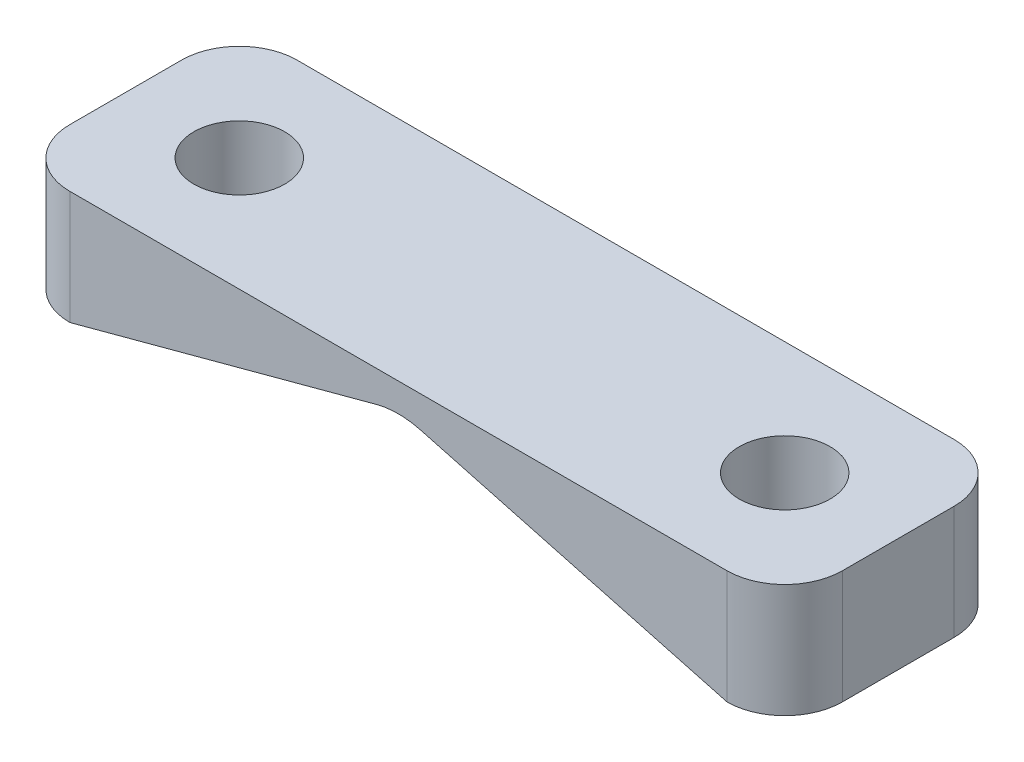
from build123d import *

# Parameters (mm, degrees)
SKETCH1_W               = 34
SKETCH1_H               = 5
BOSS_EXTRUDE1_DEPTH     = 10
CUT_EXTRUDE1_DEPTH      = 36.791060336
CUT_EXTRUDE1_DEPTH_BACK = 36.791060336
SKETCH2_R               = 3.75
FILLET1_R               = 2.54
F_4_0MM_DOWEL_HOLE1_D   = 4
CUT_EXTRUDE2_DEPTH      = 36.791060336


with BuildPart() as part:
    # Sketch1 → Boss-Extrude1 (new body)
    with BuildSketch(Plane.XY):
        with Locations((17, 2.5)):
            Rectangle(SKETCH1_W, SKETCH1_H)
    extrude(amount=BOSS_EXTRUDE1_DEPTH)

    # Sketch2 → Cut-Extrude1 (cut, two sides: drawn at the far end of the back side and taken through both)
    with BuildSketch(Plane.XY.offset(10).offset(-CUT_EXTRUDE1_DEPTH_BACK)):
        with Locations((17, 0)):
            Circle(SKETCH2_R)
    extrude(amount=CUT_EXTRUDE1_DEPTH + CUT_EXTRUDE1_DEPTH_BACK, mode=Mode.SUBTRACT)

    # Fillet1
    fillet1_edges = [part.edges().sort_by_distance(p)[0] for p in [
        (0, 2.5, 0),
        (34, 2.5, 0),
        (34, 2.5, 10),
        (0, 2.5, 10),
    ]]
    fillet(fillet1_edges, radius=FILLET1_R)

    # Ø4.0mm Dowel Hole1 (through all)
    with Locations(Plane(origin=(0, 5, 0), x_dir=(1, 0, 0), z_dir=(0, 1, 0))):
        with Locations((5, -5), (29, -5)):
            Hole(F_4_0MM_DOWEL_HOLE1_D / 2)

    # Sketch6 → Cut-Extrude2 (cut, symmetric)
    with BuildSketch(Plane(origin=(0, 0, 0), x_dir=(-1, 0, 0), z_dir=(0, 0, -1))):
        Polygon((-2.54, 0), (-16.042260033, 3.62563569), (-16.042260033, 0), align=None)
    cut_extrude2 = extrude(amount=CUT_EXTRUDE2_DEPTH, both=True, mode=Mode.SUBTRACT)

    # Mirror1: Cut-Extrude2 across plane
    add(cut_extrude2.mirror(Plane(origin=(17, 0, 0), x_dir=(0, 0, 1), z_dir=(1, 0, 0))), mode=Mode.SUBTRACT)


solid = part.part
